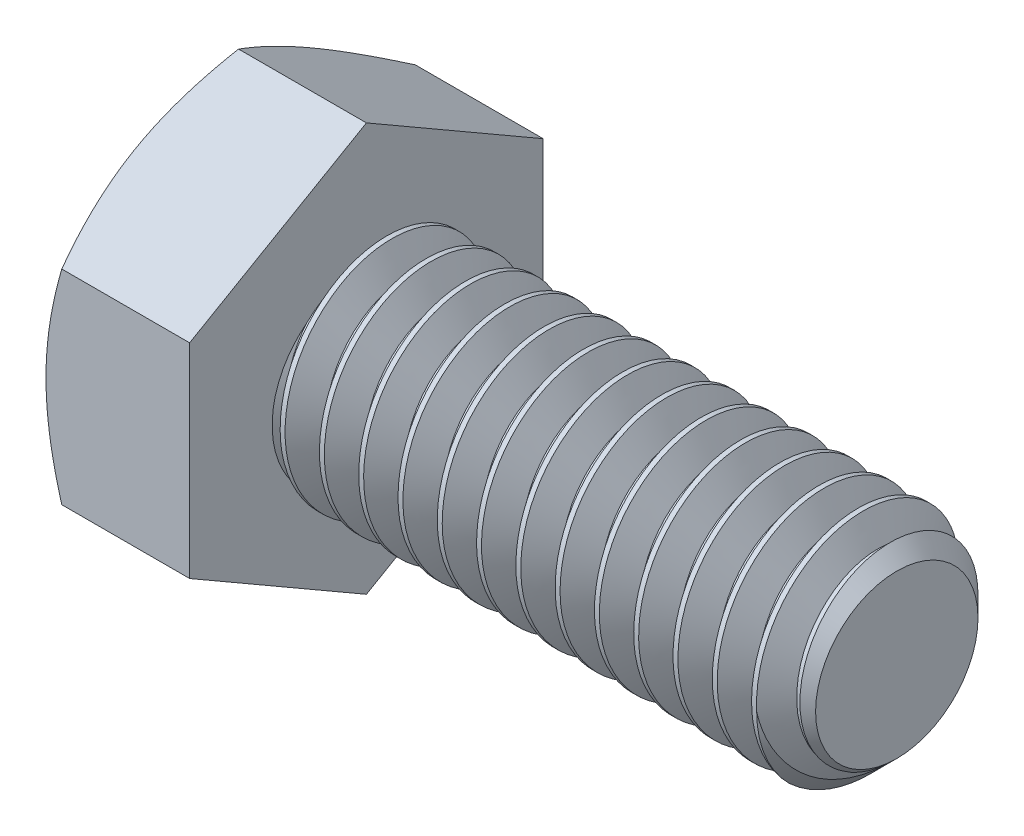
from build123d import *

# Parameters (mm, degrees)
SKETCH5_R           = 3.9751
BOSS_EXTRUDE3_DEPTH = 19.05
CHAMFER1_SIZE       = 1.058333333
BOSS_EXTRUDE4_DEPTH = 5.159375
SKETCH12_OUTSIDE_W  = 114.714
SKETCH12_OUTSIDE_H  = 116.678
SKETCH12_OUTSIDE_R  = 6.35
CUT_EXTRUDE1_DEPTH  = 27.080254432
CUT_EXTRUDE1_DRAFT  = -60
CUT_SWEEP1_PITCH    = 1.411111111
BOSS_EXTRUDE5_DEPTH = 4.592218


with BuildPart() as part:
    # Sketch5 → Boss-Extrude3 (new body)
    with BuildSketch(Plane(origin=(12.1046875, 0, 0), x_dir=(0, 0, -1), z_dir=(1, 0, 0))):
        Circle(SKETCH5_R)
    extrude(amount=-BOSS_EXTRUDE3_DEPTH)

    # Chamfer1
    chamfer1_edges = [part.edges().sort_by_distance(p)[0] for p in [
        (12.1046875, 0, 3.9751),
    ]]
    chamfer(chamfer1_edges, length=CHAMFER1_SIZE)

    # Sketch11 → Boss-Extrude4 (add)
    with BuildSketch(Plane.ZY.offset(6.9453125)):
        Polygon((0, 7.332348419), (-6.35, 3.666174209), (-6.35, -3.666174209), (0, -7.332348419), (6.35, -3.666174209), (6.35, 3.666174209), align=None)
    extrude(amount=BOSS_EXTRUDE4_DEPTH)


with BuildPart() as cut_extrude1_tool:
    # Sketch12 outside → Cut-Extrude1 (with draft: the straight prism first)
    with BuildSketch(Plane.ZY.offset(12.1046875)):
        Rectangle(SKETCH12_OUTSIDE_W, SKETCH12_OUTSIDE_H)
        Circle(SKETCH12_OUTSIDE_R, mode=Mode.SUBTRACT)
    extrude(amount=-CUT_EXTRUDE1_DEPTH)
    # Cut-Extrude1: the draft: its side faces are tilted about the plane it starts from
    cut_extrude1_sides = [cut_extrude1_tool.faces().sort_by_distance(p)[0] for p in [
        (1.435439716, -58.339, 0),
        (1.435439716, 0, 57.357),
        (1.435439716, 58.339, 0),
        (1.435439716, 0, -57.357),
        (1.435439716, 0, -6.35),
    ]]
    draft(cut_extrude1_sides, Plane.ZY.offset(12.1046875), CUT_EXTRUDE1_DRAFT)


with BuildPart() as part_1:
    add(part.part)

    # Cut-Extrude1: cut by cut_extrude1_tool
    add(cut_extrude1_tool.part, mode=Mode.SUBTRACT)

    # Cut-Sweep1: the profile of Sketch10 profile screwed along a right-hand helix of 14.5 turns, 8 arcs to a turn; built about Z, then put on its axis
    cut_sweep1_z = Axis((0, 0, 0), (0, 0, 1))
    cut_sweep1_corners = [(3.9754, 0, 0.000173205), (3.058556448, 0, -0.529166667), (3.058556448, 0, -0.705555556), (3.9754, 0, -1.234895427)]
    with BuildLine(mode=Mode.PRIVATE) as cut_sweep1_profile:
        Line(cut_sweep1_corners[0], cut_sweep1_corners[1])
        Line(cut_sweep1_corners[1], cut_sweep1_corners[2])
        Line(cut_sweep1_corners[2], cut_sweep1_corners[3])
        Line(cut_sweep1_corners[3], cut_sweep1_corners[0])
    cut_sweep1_cap = Face(cut_sweep1_profile.wire())
    cut_sweep1_turn_angles = [0, 22.5, 45, 67.5, 90, 112.5, 135, 157.5, 180, 202.5, 225, 247.5, 270, 292.5, 315, 337.5, 360]
    cut_sweep1_turn_weights = [1, 0.9238795325112867, 1, 0.9238795325112867, 1, 0.9238795325112867, 1, 0.9238795325112867, 1, 0.9238795325112867, 1, 0.9238795325112867, 1, 0.9238795325112867, 1, 0.9238795325112867, 1]
    cut_sweep1_turn_rails = [Edge.make_bspline([Vector(p[0], p[1], 0).rotate(cut_sweep1_z, cut_sweep1_turn_angles[k]) / cut_sweep1_turn_weights[k] + Vector(0, 0, p[2] + CUT_SWEEP1_PITCH * cut_sweep1_turn_angles[k] / 360) for k in range(17)], [0, 0, 0, 1, 1, 2, 2, 3, 3, 4, 4, 5, 5, 6, 6, 7, 7, 8, 8, 8], 2, cut_sweep1_turn_weights) for p in cut_sweep1_corners]
    cut_sweep1_turn_sides = [Face.make_surface_from_curves(cut_sweep1_turn_rails[p[0]], cut_sweep1_turn_rails[p[1]]) for p in [(0, 1), (1, 2), (2, 3), (3, 0)]]
    cut_sweep1_last_angles = [5040, 5062.5, 5085, 5107.5, 5130, 5152.5, 5175, 5197.500000001, 5220.000000003]
    cut_sweep1_last_weights = [1, 0.9238795325112867, 1, 0.9238795325112867, 1, 0.9238795325112867, 1, 0.9238795325016737, 1]
    cut_sweep1_last_rails = [Edge.make_bspline([Vector(p[0], p[1], 0).rotate(cut_sweep1_z, cut_sweep1_last_angles[k]) / cut_sweep1_last_weights[k] + Vector(0, 0, p[2] + CUT_SWEEP1_PITCH * cut_sweep1_last_angles[k] / 360) for k in range(9)], [0, 0, 0, 1, 1, 2, 2, 3, 3, 4, 4, 4], 2, cut_sweep1_last_weights) for p in cut_sweep1_corners]
    cut_sweep1_last_sides = [Face.make_surface_from_curves(cut_sweep1_last_rails[p[0]], cut_sweep1_last_rails[p[1]]) for p in [(0, 1), (1, 2), (2, 3), (3, 0)]]
    cut_sweep1 = Plane(origin=(12.1046875, 0, 0), x_dir=(0, 1, 0), z_dir=(-1, 0, 0)) * Solid(Shell([*[p.moved(Location((0, 0, CUT_SWEEP1_PITCH * i))) for i in range(14) for p in cut_sweep1_turn_sides], *cut_sweep1_last_sides, cut_sweep1_cap, cut_sweep1_cap.rotate(cut_sweep1_z, 5220.000000003).moved(Location((0, 0, CUT_SWEEP1_PITCH * 5220.000000003 / 360)))]))
    add(cut_sweep1, mode=Mode.SUBTRACT)

    # Sketch13 → Boss-Extrude5 (add)
    with BuildSketch(Plane(origin=(-6.9453125, 0, 0), x_dir=(0, 0, -1), z_dir=(1, 0, 0))):
        Polygon((0, 7.332348419), (-6.35, 3.666174209), (-6.35, -3.666174209), (0, -7.332348419), (6.35, -3.666174209), (6.35, 3.666174209), align=None)
    extrude(amount=-BOSS_EXTRUDE5_DEPTH)


solid = part_1.part
